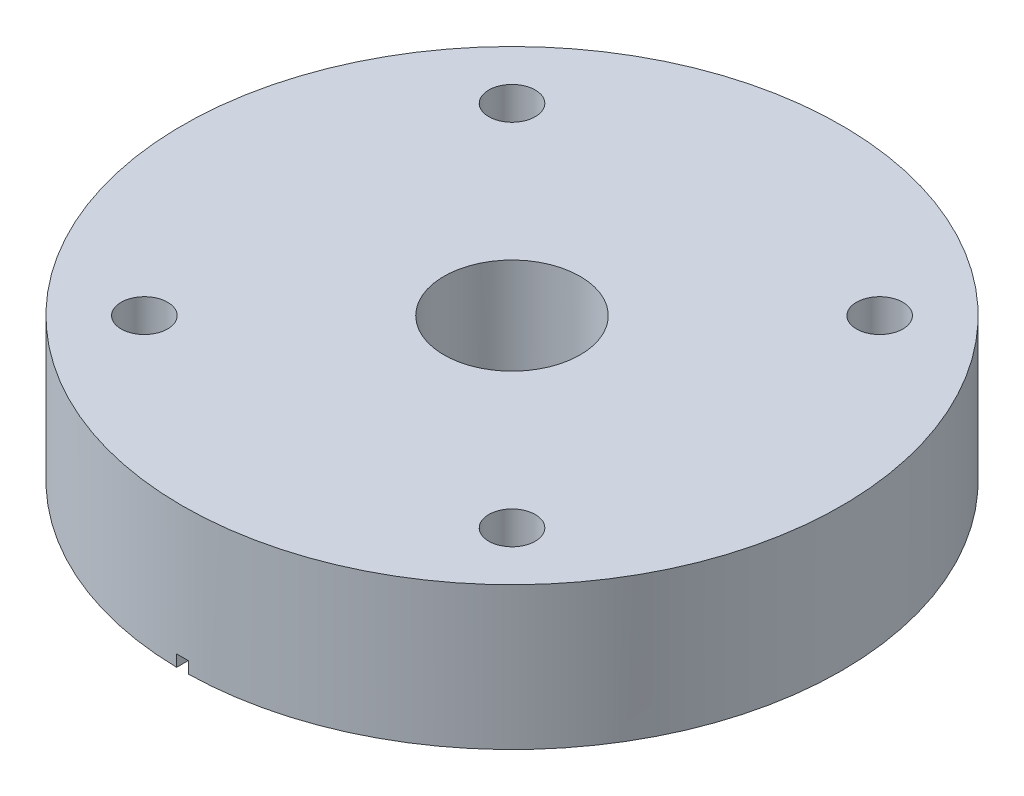
from build123d import *

# Parameters (mm, degrees)
SKETCH1_R                 = 56.35625
SKETCH1_R_2               = 3.96875
SKETCH1_R_3               = 10.1459
BODY_AND_MAIN_HOLES_DEPTH = 24.4122
SKETCH3_R                 = 11.6459
SEAL_BORE_DEPTH           = 22.4122
SKETCH4_W                 = 2
SKETCH4_H                 = 112.7125
VENT_SLOT_DEPTH           = 2


with BuildPart() as part:
    # Sketch1 → body and main holes (new body)
    with BuildSketch(Plane(origin=(0, 0, 0), x_dir=(1, 0, 0), z_dir=(0, 1, 0))):
        Circle(SKETCH1_R)
        with Locations((-31.430896424, 31.430896424)):
            Circle(SKETCH1_R_2, mode=Mode.SUBTRACT)
        with Locations((31.430896424, 31.430896424)):
            Circle(SKETCH1_R_2, mode=Mode.SUBTRACT)
        with Locations((31.430896424, -31.430896424)):
            Circle(SKETCH1_R_2, mode=Mode.SUBTRACT)
        with Locations((-31.430896424, -31.430896424)):
            Circle(SKETCH1_R_2, mode=Mode.SUBTRACT)
        Circle(SKETCH1_R_3, mode=Mode.SUBTRACT)
    extrude(amount=BODY_AND_MAIN_HOLES_DEPTH)

    # Sketch3 → seal bore (cut)
    with BuildSketch(Plane.XZ.offset(-24.4122)):
        Circle(SKETCH3_R)
    extrude(amount=SEAL_BORE_DEPTH, mode=Mode.SUBTRACT)

    # Sketch4 → vent slot (cut)
    with BuildSketch(Plane.XZ):
        Rectangle(SKETCH4_W, SKETCH4_H)
    extrude(amount=-VENT_SLOT_DEPTH, mode=Mode.SUBTRACT)


solid = part.part
